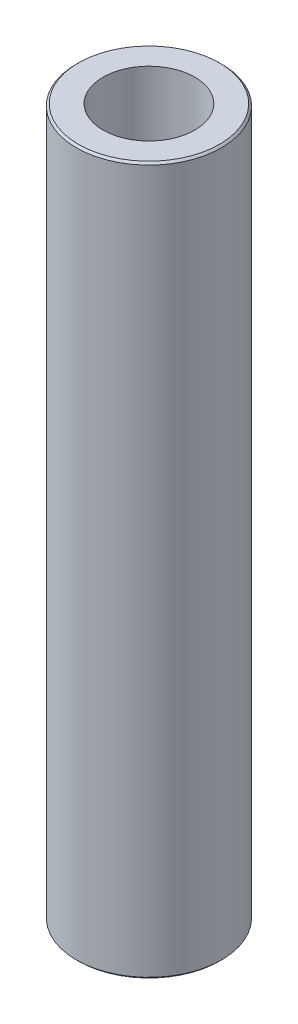
from build123d import *
from OCP.BRepFilletAPI import BRepFilletAPI_MakeChamfer

# Parameters (mm, degrees)
SKETCH1_R           = 25
BOSS_EXTRUDE1_DEPTH = 243.637174074
SKETCH2_R           = 15.805896967
CUT_EXTRUDE1_DEPTH  = 247.189099253
CHAMFER1_SIZE       = 0.678027364
CHAMFER1_SIZE2      = 0.693335487


with BuildPart() as part:
    # Sketch1 → Boss-Extrude1 (new body)
    with BuildSketch(Plane(origin=(0, 0, 0), x_dir=(1, 0, 0), z_dir=(0, 1, 0))):
        Circle(SKETCH1_R)
    extrude(amount=BOSS_EXTRUDE1_DEPTH)

    # Sketch2 → Cut-Extrude1 (cut, through all)
    with BuildSketch(Plane(origin=(0, 0, 0), x_dir=(1, 0, 0), z_dir=(0, 1, 0))):
        Circle(SKETCH2_R)
    extrude(amount=CUT_EXTRUDE1_DEPTH, mode=Mode.SUBTRACT)

    # Chamfer1: one chamfer whose edges measure the first distance from different faces: ONE call of the kernel's chamfer builder (chamfer() names one face for all edges)
    chamfer1_edges_1 = [part.edges().sort_by_distance(p)[0] for p in [
        (-25, 243.637174074, 0),
    ]]
    chamfer1_side_1 = [part.faces().sort_by_distance(p)[0] for p in [
        (-25, 121.818587037, 0),
    ]]
    chamfer1_edges_2 = [part.edges().sort_by_distance(p)[0] for p in [
        (-25, 0, 0),
    ]]
    chamfer1_side_2 = [part.faces().sort_by_distance(p)[0] for p in [
        (-24.292893219, 0, 0),
    ]]
    chamfer1 = BRepFilletAPI_MakeChamfer(part.part.solid().wrapped)
    for e in chamfer1_edges_1:
        chamfer1.Add(CHAMFER1_SIZE, CHAMFER1_SIZE2, e.wrapped, chamfer1_side_1[0].wrapped)  # the first distance lies on this face
    for e in chamfer1_edges_2:
        chamfer1.Add(CHAMFER1_SIZE, CHAMFER1_SIZE2, e.wrapped, chamfer1_side_2[0].wrapped)  # the first distance lies on this face
    add(Compound.cast(chamfer1.Shape()), mode=Mode.REPLACE)


solid = part.part
